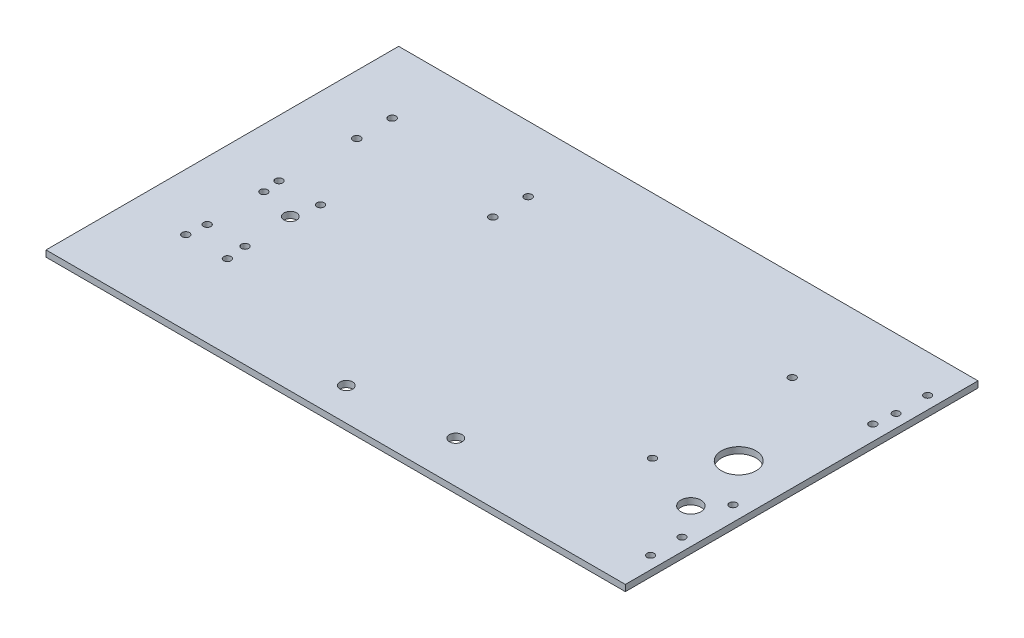
from build123d import *

# Parameters (mm, degrees)
SKETCH1_W           = 317.5
SKETCH1_H           = 177.8
SKETCH1_R           = 3.175
SKETCH1_R_2         = 8.73125
SKETCH1_R_3         = 1.905
BOSS_EXTRUDE1_DEPTH = 3.175
SKETCH3_R           = 3.175
CUT_EXTRUDE2_DEPTH  = 182.974869488
SKETCH4_W           = 25.4
SKETCH4_H           = 177.8
CUT_EXTRUDE3_DEPTH  = 182.974869488
SKETCH5_R           = 5.08
CUT_EXTRUDE4_DEPTH  = 182.974869488
SKETCH6_R           = 1.8034
CUT_EXTRUDE5_DEPTH  = 182.974869488
SKETCH7_R           = 1.8415
CUT_EXTRUDE6_DEPTH  = 182.974869488


with BuildPart() as part:
    # Sketch1 → Boss-Extrude1 (new body)
    with BuildSketch(Plane(origin=(0, 0, 0), x_dir=(1, 0, 0), z_dir=(0, 1, 0))):
        Rectangle(SKETCH1_W, SKETCH1_H)
        with Locations((-111.76, -12.7)):
            Circle(SKETCH1_R, mode=Mode.SUBTRACT)
        with Locations((107.95, -6.35)):
            Circle(SKETCH1_R_2, mode=Mode.SUBTRACT)
        with Locations((-129.032, 55.88)):
            Circle(SKETCH1_R_3, mode=Mode.SUBTRACT)
        with Locations((-60.452, 55.88)):
            Circle(SKETCH1_R_3, mode=Mode.SUBTRACT)
        with Locations((-129.032, 38.1)):
            Circle(SKETCH1_R_3, mode=Mode.SUBTRACT)
        with Locations((-60.452, 38.1)):
            Circle(SKETCH1_R_3, mode=Mode.SUBTRACT)
    extrude(amount=BOSS_EXTRUDE1_DEPTH)

    # Sketch3 → Cut-Extrude2 (cut, through all)
    with BuildSketch(Plane(origin=(0, 0, 0), x_dir=(-1, 0, 0), z_dir=(0, -1, 0))):
        with Locations((23.829539609, -72.39)):
            Circle(SKETCH3_R)
        with Locations((-26.764302072, -67.818)):
            Circle(SKETCH3_R)
    extrude(amount=-CUT_EXTRUDE2_DEPTH, mode=Mode.SUBTRACT)

    # Sketch4 → Cut-Extrude3 (cut, through all)
    with BuildSketch(Plane(origin=(0, 3.175, 0), x_dir=(1, 0, 0), z_dir=(0, 1, 0))):
        with Locations((146.05, 0)):
            Rectangle(SKETCH4_W, SKETCH4_H)
    extrude(amount=-CUT_EXTRUDE3_DEPTH, mode=Mode.SUBTRACT)

    # Sketch5 → Cut-Extrude4 (cut, through all)
    with BuildSketch(Plane(origin=(0, 3.175, 0), x_dir=(1, 0, 0), z_dir=(0, 1, 0))):
        with Locations((115.57, -38.1)):
            Circle(SKETCH5_R)
    extrude(amount=-CUT_EXTRUDE4_DEPTH, mode=Mode.SUBTRACT)

    # Sketch6 → Cut-Extrude5 (cut, through all)
    with BuildSketch(Plane.XZ):
        with Locations((127, 69.85)):
            Circle(SKETCH6_R)
        with Locations((127, 53.975)):
            Circle(SKETCH6_R)
        with Locations((127, -53.975)):
            Circle(SKETCH6_R)
        with Locations((127, -69.85)):
            Circle(SKETCH6_R)
    extrude(amount=-CUT_EXTRUDE5_DEPTH, mode=Mode.SUBTRACT)

    # Sketch7 → Cut-Extrude6 (cut, through all)
    with BuildSketch(Plane(origin=(0, 3.175, 0), x_dir=(1, 0, 0), z_dir=(0, 1, 0))):
        with Locations((125.73, 43.4975)):
            Circle(SKETCH7_R)
        with Locations((85.09, 43.4975)):
            Circle(SKETCH7_R)
        with Locations((85.09, -26.9875)):
            Circle(SKETCH7_R)
        with Locations((125.73, -26.9875)):
            Circle(SKETCH7_R)
        with Locations((-130.175, -46.99)):
            Circle(SKETCH7_R)
        with Locations((-109.22, -46.99)):
            Circle(SKETCH7_R)
        with Locations((-129.2225, -37.1475)):
            Circle(SKETCH7_R)
        with Locations((-110.1725, -37.1475)):
            Circle(SKETCH7_R)
        with Locations((-129.2225, -8.5725)):
            Circle(SKETCH7_R)
        with Locations((-130.175, 0)):
            Circle(SKETCH7_R)
        with Locations((-109.22, 0)):
            Circle(SKETCH7_R)
    extrude(amount=-CUT_EXTRUDE6_DEPTH, mode=Mode.SUBTRACT)


solid = part.part
